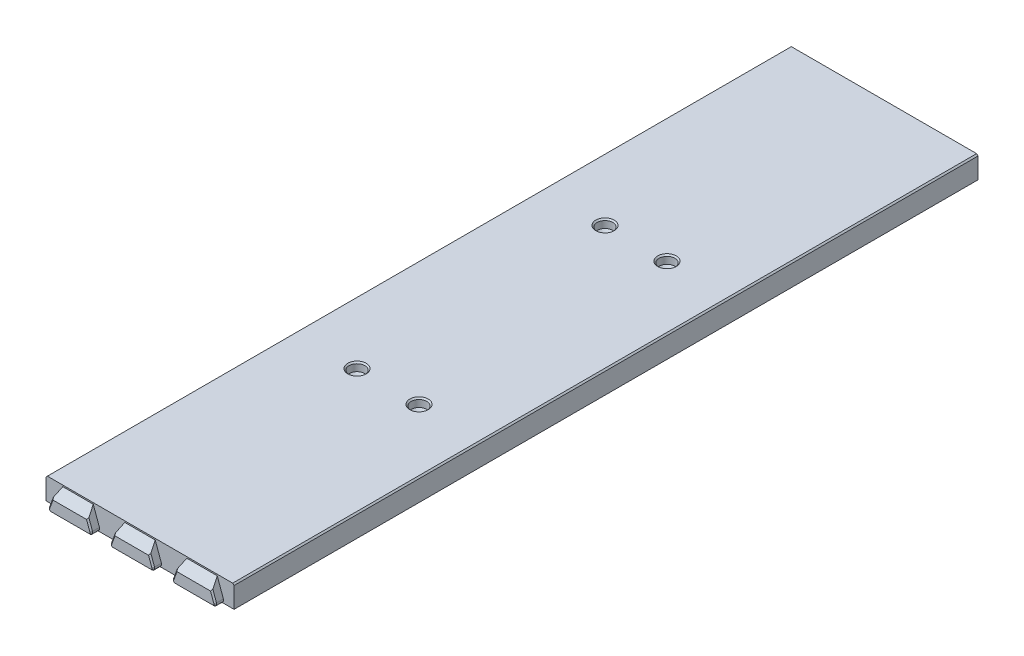
from build123d import *

# Parameters (mm, degrees)
BOSS_EXTRUDE1_DEPTH             = 135
SKETCH7_W                       = 64.25
SKETCH7_H                       = 6
BOSS_EXTRUDE7_DEPTH             = 1
BOSS_EXTRUDE4_DEPTH             = 3
BOSS_EXTRUDE8_REACH             = 141.476
BOSS_EXTRUDE8_DIRECTION_2_DEPTH = 2
CHAMFER4_SIZE                   = 0.5
FILLET4_R                       = 1
CHAMFER6_SIZE                   = 0.5
FILLET2_R                       = 2
CHAMFER4_OF_MIRROR2_SIZE        = 0.5
FILLET4_OF_MIRROR2_R            = 1
CHAMFER6_OF_MIRROR2_SIZE        = 0.5
FILLET2_OF_MIRROR2_R            = 2
BOSS_EXTRUDE9_REACH             = 277.241
SKETCH9_R                       = 5
FILLET3_R                       = 3
SKETCH10_R                      = 1.85
CUT_EXTRUDE2_DEPTH              = 276.240832045
SKETCH11_R                      = 2.85
CUT_EXTRUDE3_DEPTH              = 3
CHAMFER7_SIZE                   = 1
CUT_EXTRUDE4_DEPTH              = 276.240832045
CUT_EXTRUDE4_DEPTH_BACK         = 276.240832045
CHAMFER8_SIZE                   = 0.5


with BuildPart() as part:
    # Sketch1 → Boss-Extrude1 (new body)
    with BuildSketch(Plane.XY):
        Polygon((-34.125, 0), (-34.125, 8), (34.125, 8), (34.125, 0), (32.125, 0), (32.125, 6), (-32.125, 6), (-32.125, 0), align=None)
    boss_extrude1 = extrude(amount=-BOSS_EXTRUDE1_DEPTH)

    # Sketch7 → Boss-Extrude7 (add)
    with BuildSketch(Plane.XY):
        with Locations((0, 3)):
            Rectangle(SKETCH7_W, SKETCH7_H)
    boss_extrude7 = extrude(amount=-BOSS_EXTRUDE7_DEPTH)

    # Sketch2 → Boss-Extrude4 (add)
    with BuildSketch(Plane.XY):
        Polygon((17.161761874, 8), (14.25, 0), (30.75, 0), (27.838238126, 8), align=None)
        Polygon((-5.338238126, 8), (-8.25, 0), (8.25, 0), (5.338238126, 8), align=None)
        Polygon((-27.838238126, 8), (-30.75, 0), (-14.25, 0), (-17.161761874, 8), align=None)
    boss_extrude4 = extrude(amount=BOSS_EXTRUDE4_DEPTH)

    # Sketch8 → Boss-Extrude8 (add, up to next)
    with BuildSketch(Plane.XZ, mode=Mode.PRIVATE) as boss_extrude8_sk1:
        Polygon((-32.6, -20.258341264), (-28.9, -21.605031131), (-28.9, -23.394968869), (-32.6, -24.741658736), align=None)
    boss_extrude8_tool1 = extrude(boss_extrude8_sk1.sketch, amount=-BOSS_EXTRUDE8_REACH, mode=Mode.PRIVATE) - part.part
    # Sketch8 → Boss-Extrude8 (add, up to next)
    with BuildSketch(Plane.XZ, mode=Mode.PRIVATE) as boss_extrude8_sk2:
        Polygon((-32.6, -132.758341264), (-28.9, -134.105031131), (-28.9, -134.85), (-28.9, -135), (-32.6, -135), (-32.6, -134.85), align=None)
    boss_extrude8_tool2 = extrude(boss_extrude8_sk2.sketch, amount=-BOSS_EXTRUDE8_REACH, mode=Mode.PRIVATE) - part.part
    # Sketch8 → Boss-Extrude8 (add, up to next)
    with BuildSketch(Plane.XZ, mode=Mode.PRIVATE) as boss_extrude8_sk3:
        Polygon((32.6, -24.741658736), (32.6, -20.258341264), (28.9, -21.605031131), (28.9, -23.394968869), align=None)
    boss_extrude8_tool3 = extrude(boss_extrude8_sk3.sketch, amount=-BOSS_EXTRUDE8_REACH, mode=Mode.PRIVATE) - part.part
    # Sketch8 → Boss-Extrude8 (add, up to next)
    with BuildSketch(Plane.XZ, mode=Mode.PRIVATE) as boss_extrude8_sk4:
        Polygon((32.6, -134.85), (32.6, -135), (28.9, -135), (28.9, -134.85), (28.9, -134.105031131), (32.6, -132.758341264), align=None)
    boss_extrude8_tool4 = extrude(boss_extrude8_sk4.sketch, amount=-BOSS_EXTRUDE8_REACH, mode=Mode.PRIVATE) - part.part
    boss_extrude8_1 = boss_extrude8_tool1.solids().sort_by_distance((-31.014762, 0, -22.5))[0]
    add(boss_extrude8_1)
    boss_extrude8_2 = boss_extrude8_tool2.solids().sort_by_distance((-31.014762, 0, -134.16766))[0]
    add(boss_extrude8_2)
    boss_extrude8_3 = boss_extrude8_tool3.solids().sort_by_distance((31.014762, 0, -22.5))[0]
    add(boss_extrude8_3)
    boss_extrude8_4 = boss_extrude8_tool4.solids().sort_by_distance((31.014762, 0, -134.16766))[0]
    add(boss_extrude8_4)
    boss_extrude8 = boss_extrude8_1 + boss_extrude8_2 + boss_extrude8_3 + boss_extrude8_4  # Boss-Extrude8 as one shape, for the pattern or mirror that repeats it

    # Sketch8 → Boss-Extrude8 direction 2 (add)
    with BuildSketch(Plane.XZ):
        Polygon((-32.6, -20.258341264), (-28.9, -21.605031131), (-28.9, -23.394968869), (-32.6, -24.741658736), align=None)
        Polygon((-32.6, -132.758341264), (-28.9, -134.105031131), (-28.9, -134.85), (-28.9, -135), (-32.6, -135), (-32.6, -134.85), align=None)
        Polygon((32.6, -24.741658736), (32.6, -20.258341264), (28.9, -21.605031131), (28.9, -23.394968869), align=None)
        Polygon((32.6, -134.85), (32.6, -135), (28.9, -135), (28.9, -134.85), (28.9, -134.105031131), (32.6, -132.758341264), align=None)
    boss_extrude8_direction_2 = extrude(amount=BOSS_EXTRUDE8_DIRECTION_2_DEPTH)

    # Chamfer4
    chamfer4_edges = [part.edges().sort_by_distance(p)[0] for p in [
        (-32.6, -2, -133.879170632),
        (-28.9, -2, -134.552515565),
        (-30.75, -2, -133.431686197),
        (28.9, -2, -22.5),
        (30.75, -2, -24.068313803),
        (32.6, -2, -22.5),
        (30.75, -2, -20.931686197),
        (32.6, -2, -133.879170632),
        (30.75, -2, -133.431686197),
        (28.9, -2, -134.552515565),
        (-32.6, -2, -22.5),
        (-30.75, -2, -24.068313803),
        (-28.9, -2, -22.5),
        (-30.75, -2, -20.931686197),
    ]]
    chamfer(chamfer4_edges, length=CHAMFER4_SIZE)

    # Fillet4
    fillet4_edges = [part.edges().sort_by_distance(p)[0] for p in [
        (14.25, 0, 1.5),
        (30.75, 0, 1.5),
        (-8.25, 0, 1.5),
        (8.25, 0, 1.5),
        (-30.75, 0, 1.5),
        (-14.25, 0, 1.5),
    ]]
    fillet(fillet4_edges, radius=FILLET4_R)

    # Chamfer6
    chamfer6_edges = [part.edges().sort_by_distance(p)[0] for p in [
        (29.04989137, 4.671010072, 3),
        (22.5, 0, 3),
        (0, 0, 3),
        (-22.5, 0, 3),
        (14.858995962, 0.426423564, 3),
        (30.141004038, 0.426423564, 3),
        (6.54989137, 4.671010072, 3),
        (-7.641004038, 0.426423564, 3),
        (7.641004038, 0.426423564, 3),
        (-15.95010863, 4.671010072, 3),
        (-30.141004038, 0.426423564, 3),
        (-14.858995962, 0.426423564, 3),
        (15.95010863, 4.671010072, 3),
        (-6.54989137, 4.671010072, 3),
        (-29.04989137, 4.671010072, 3),
    ]]
    chamfer(chamfer6_edges, length=CHAMFER6_SIZE)

    # Fillet2
    fillet2_edges = [part.edges().sort_by_distance(p)[0] for p in [
        (-32.125, 6, -78.75),
        (-32.125, 3, -132.931227125),
        (-28.9, 6, -134.552515565),
        (-30.5125, 6, -133.518129128),
        (32.125, 6, -10.715613563),
        (32.125, 3, -24.568772875),
        (32.125, 3, -20.431227125),
        (30.5125, 6, -23.981870872),
        (28.9, 6, -22.5),
        (30.5125, 6, -21.018129128),
        (32.125, 6, -78.75),
        (32.125, 3, -132.931227125),
        (30.5125, 6, -133.518129128),
        (28.9, 6, -134.552515565),
        (-32.125, 3, -1),
        (0, 6, -1),
        (32.125, 3, -1),
        (-32.125, 6, -10.715613563),
        (-32.125, 3, -24.568772875),
        (-30.5125, 6, -23.981870872),
        (-30.5125, 6, -21.018129128),
        (-28.9, 6, -22.5),
    ]]
    fillet(fillet2_edges, radius=FILLET2_R)


with BuildPart() as mirror2_1:
    # Mirror2: Boss-Extrude1, Boss-Extrude7, Boss-Extrude4, Boss-Extrude8, Boss-Extrude8 direction 2 across plane
    add(boss_extrude1.mirror(Plane.XY.offset(-135)))
    add(boss_extrude7.mirror(Plane.XY.offset(-135)))
    add(boss_extrude4.mirror(Plane.XY.offset(-135)))
    add(boss_extrude8.mirror(Plane.XY.offset(-135)))
    add(boss_extrude8_direction_2.mirror(Plane.XY.offset(-135)))

    # Chamfer4 of Mirror2
    chamfer4_of_mirror2_edges = [mirror2_1.edges().sort_by_distance(p)[0] for p in [
        (-32.6, -2, -136.120829368),
        (-28.9, -2, -135.447484435),
        (-30.75, -2, -136.568313803),
        (28.9, -2, -247.5),
        (30.75, -2, -245.931686197),
        (32.6, -2, -247.5),
        (30.75, -2, -249.068313803),
        (32.6, -2, -136.120829368),
        (30.75, -2, -136.568313803),
        (28.9, -2, -135.447484435),
        (-32.6, -2, -247.5),
        (-30.75, -2, -245.931686197),
        (-28.9, -2, -247.5),
        (-30.75, -2, -249.068313803),
    ]]
    chamfer(chamfer4_of_mirror2_edges, length=CHAMFER4_OF_MIRROR2_SIZE)

    # Fillet4 of Mirror2
    fillet4_of_mirror2_edges = [mirror2_1.edges().sort_by_distance(p)[0] for p in [
        (14.25, 0, -271.5),
        (30.75, 0, -271.5),
        (-8.25, 0, -271.5),
        (8.25, 0, -271.5),
        (-30.75, 0, -271.5),
        (-14.25, 0, -271.5),
    ]]
    fillet(fillet4_of_mirror2_edges, radius=FILLET4_OF_MIRROR2_R)

    # Chamfer6 of Mirror2
    chamfer6_of_mirror2_edges = [mirror2_1.edges().sort_by_distance(p)[0] for p in [
        (29.04989137, 4.671010072, -273),
        (22.5, 0, -273),
        (0, 0, -273),
        (-22.5, 0, -273),
        (14.858995962, 0.426423564, -273),
        (30.141004038, 0.426423564, -273),
        (6.54989137, 4.671010072, -273),
        (-7.641004038, 0.426423564, -273),
        (7.641004038, 0.426423564, -273),
        (-15.95010863, 4.671010072, -273),
        (-30.141004038, 0.426423564, -273),
        (-14.858995962, 0.426423564, -273),
        (15.95010863, 4.671010072, -273),
        (-6.54989137, 4.671010072, -273),
        (-29.04989137, 4.671010072, -273),
    ]]
    chamfer(chamfer6_of_mirror2_edges, length=CHAMFER6_OF_MIRROR2_SIZE)

    # Fillet2 of Mirror2
    fillet2_of_mirror2_edges = [mirror2_1.edges().sort_by_distance(p)[0] for p in [
        (-32.125, 6, -191.25),
        (-32.125, 3, -137.068772875),
        (-28.9, 6, -135.447484435),
        (-30.5125, 6, -136.481870872),
        (32.125, 6, -259.284386437),
        (32.125, 3, -245.431227125),
        (32.125, 3, -249.568772875),
        (30.5125, 6, -246.018129128),
        (28.9, 6, -247.5),
        (30.5125, 6, -248.981870872),
        (32.125, 6, -191.25),
        (32.125, 3, -137.068772875),
        (30.5125, 6, -136.481870872),
        (28.9, 6, -135.447484435),
        (-32.125, 3, -269),
        (0, 6, -269),
        (32.125, 3, -269),
        (-32.125, 6, -259.284386437),
        (-32.125, 3, -245.431227125),
        (-30.5125, 6, -246.018129128),
        (-30.5125, 6, -248.981870872),
        (-28.9, 6, -247.5),
    ]]
    fillet(fillet2_of_mirror2_edges, radius=FILLET2_OF_MIRROR2_R)


with BuildPart() as part_1:
    add(part.part)

    # Mirror2 united with what the copies touc: union Mirror2_1
    add(mirror2_1.part)

    # Sketch9 → Boss-Extrude9 (add, up to next)
    with BuildSketch(Plane(origin=(0, 0, 0), x_dir=(1, 0, 0), z_dir=(0, 1, 0)), mode=Mode.PRIVATE) as boss_extrude9_sk1:
        with Locations(Location((-11.25, 90, 0), (0, 0, 90))):
            Circle(SKETCH9_R)
    boss_extrude9_tool1 = extrude(boss_extrude9_sk1.sketch, amount=BOSS_EXTRUDE9_REACH, mode=Mode.PRIVATE) - part_1.part
    # Sketch9 → Boss-Extrude9 (add, up to next)
    with BuildSketch(Plane(origin=(0, 0, 0), x_dir=(1, 0, 0), z_dir=(0, 1, 0)), mode=Mode.PRIVATE) as boss_extrude9_sk2:
        with Locations(Location((11.25, 90, 0), (0, 0, 90))):
            Circle(SKETCH9_R)
    boss_extrude9_tool2 = extrude(boss_extrude9_sk2.sketch, amount=BOSS_EXTRUDE9_REACH, mode=Mode.PRIVATE) - part_1.part
    # Sketch9 → Boss-Extrude9 (add, up to next)
    with BuildSketch(Plane(origin=(0, 0, 0), x_dir=(1, 0, 0), z_dir=(0, 1, 0)), mode=Mode.PRIVATE) as boss_extrude9_sk3:
        with Locations(Location((11.25, 180, 0), (0, 0, 90))):
            Circle(SKETCH9_R)
    boss_extrude9_tool3 = extrude(boss_extrude9_sk3.sketch, amount=BOSS_EXTRUDE9_REACH, mode=Mode.PRIVATE) - part_1.part
    # Sketch9 → Boss-Extrude9 (add, up to next)
    with BuildSketch(Plane(origin=(0, 0, 0), x_dir=(1, 0, 0), z_dir=(0, 1, 0)), mode=Mode.PRIVATE) as boss_extrude9_sk4:
        with Locations(Location((-11.25, 180, 0), (0, 0, 90))):
            Circle(SKETCH9_R)
    boss_extrude9_tool4 = extrude(boss_extrude9_sk4.sketch, amount=BOSS_EXTRUDE9_REACH, mode=Mode.PRIVATE) - part_1.part
    add(boss_extrude9_tool1.solids().sort_by_distance((-11.25, 0, -90))[0])
    add(boss_extrude9_tool2.solids().sort_by_distance((11.25, 0, -90))[0])
    add(boss_extrude9_tool3.solids().sort_by_distance((11.25, 0, -180))[0])
    add(boss_extrude9_tool4.solids().sort_by_distance((-11.25, 0, -180))[0])

    # Fillet3
    fillet3_edges = [part_1.edges().sort_by_distance(p)[0] for p in [
        (-11.25, 6, -85),
        (-11.25, 6, -175),
        (11.25, 6, -175),
        (11.25, 6, -85),
    ]]
    fillet(fillet3_edges, radius=FILLET3_R)

    # Sketch10 → Cut-Extrude2 (cut, through all)
    with BuildSketch(Plane(origin=(0, 0, 0), x_dir=(1, 0, 0), z_dir=(0, 1, 0))):
        with Locations(Location((-11.25, 180, 0), (0, 0, 270))):
            Circle(SKETCH10_R)
        with Locations(Location((-11.25, 90, 0), (0, 0, 270))):
            Circle(SKETCH10_R)
        with Locations(Location((11.25, 90, 0), (0, 0, 270))):
            Circle(SKETCH10_R)
        with Locations(Location((11.25, 180, 0), (0, 0, 270))):
            Circle(SKETCH10_R)
    extrude(amount=CUT_EXTRUDE2_DEPTH, mode=Mode.SUBTRACT)

    # Sketch11 → Cut-Extrude3 (cut)
    with BuildSketch(Plane(origin=(0, 8, 0), x_dir=(1, 0, 0), z_dir=(0, 1, 0))):
        with Locations(Location((-11.25, 180, 0), (0, 0, 270))):
            Circle(SKETCH11_R)
        with Locations(Location((11.25, 180, 0), (0, 0, 270))):
            Circle(SKETCH11_R)
        with Locations(Location((11.25, 90, 0), (0, 0, 270))):
            Circle(SKETCH11_R)
        with Locations(Location((-11.25, 90, 0), (0, 0, 270))):
            Circle(SKETCH11_R)
    extrude(amount=-CUT_EXTRUDE3_DEPTH, mode=Mode.SUBTRACT)

    # Chamfer7
    chamfer7_edges = [part_1.edges().sort_by_distance(p)[0] for p in [
        (-11.25, 5, -91.85),
        (11.25, 5, -91.85),
        (11.25, 5, -181.85),
        (-11.25, 5, -181.85),
    ]]
    chamfer(chamfer7_edges, length=CHAMFER7_SIZE - 0.0001)  # a hair under: the kernel refuses the full size

    # Sketch12 → Cut-Extrude4 (cut, two sides: drawn at the far end of the back side and taken through both)
    with BuildSketch(Plane(origin=(0, 0, 0), x_dir=(0, 0, -1), z_dir=(1, 0, 0)).offset(-CUT_EXTRUDE4_DEPTH_BACK)):
        Polygon((0, 7.5), (-3, 4.5), (-3, 7.5), (-3, 8), (0, 8), align=None)
        Polygon((270, 8), (270, 7.5), (273, 4.5), (273, 7.5), (273, 8), align=None)
    extrude(amount=CUT_EXTRUDE4_DEPTH + CUT_EXTRUDE4_DEPTH_BACK, mode=Mode.SUBTRACT)

    # Chamfer8
    chamfer8_edges = [part_1.edges().sort_by_distance(p)[0] for p in [
        (-34.125, 8, -135),
        (34.125, 8, -135),
        (-11.25, 8, -92.85),
        (11.25, 8, -92.85),
        (11.25, 8, -182.85),
        (-11.25, 8, -182.85),
    ]]
    chamfer(chamfer8_edges, length=CHAMFER8_SIZE)


solid = part_1.part
